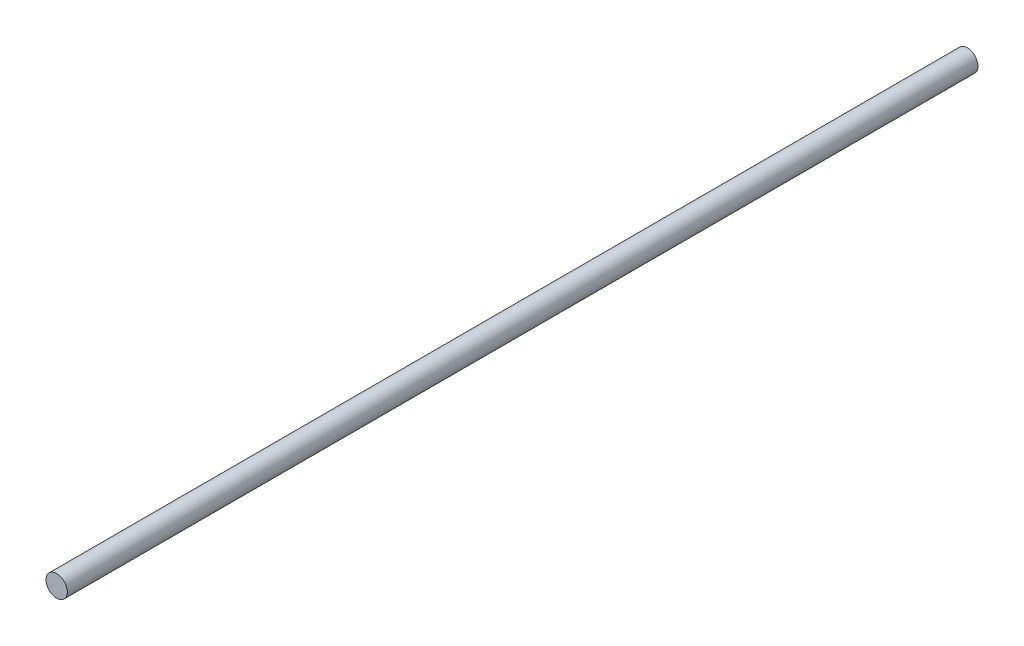
from build123d import *

# Parameters (mm, degrees)
SKETCH1_R           = 9.525
BOSS_EXTRUDE1_DEPTH = 812.8


with BuildPart() as part:
    # Sketch1 → Boss-Extrude1 (new body)
    with BuildSketch(Plane.XY):
        Circle(SKETCH1_R)
    extrude(amount=BOSS_EXTRUDE1_DEPTH)


solid = part.part
